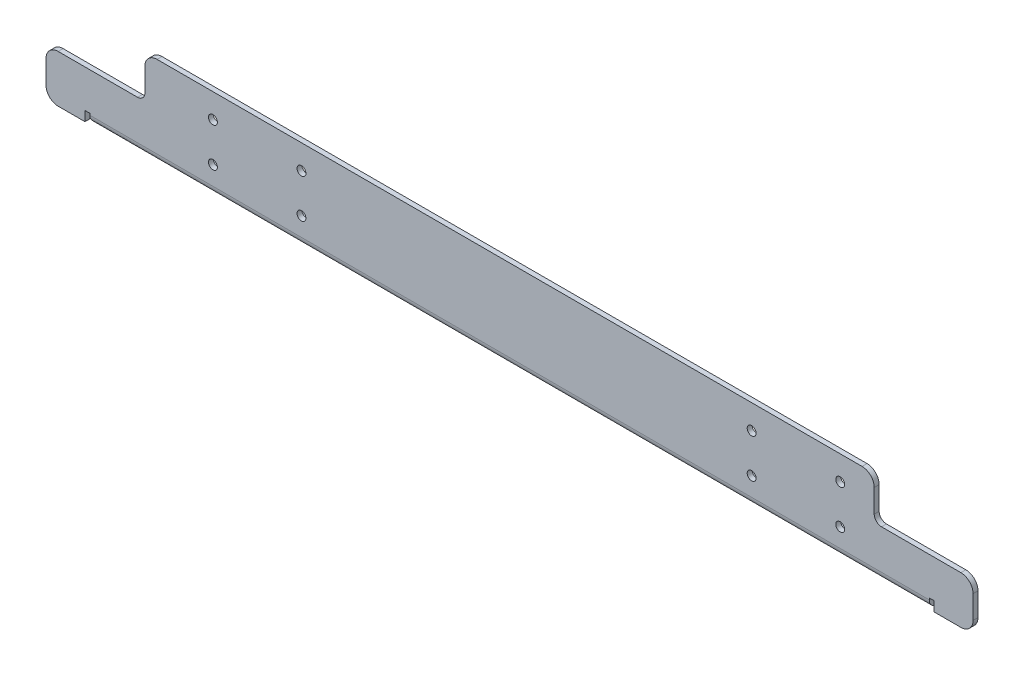
from build123d import *

# Parameters (mm, degrees)
BOSS_EXTRUDE1_START        = 8
SKETCH2_W                  = 381
SKETCH2_H                  = 2.032
BOSS_EXTRUDE1_DEPTH        = 37
SKETCH3_W                  = 345
SKETCH3_H                  = 2.032
BOSS_EXTRUDE2_DEPTH        = 10.668
SKETCH4_W                  = 40.623
SKETCH4_H                  = 17.5
CUT_EXTRUDE1_DEPTH         = 3
F_6_CLEARANCE_HOLE1_D      = 3.6576
FILLET2_R                  = 5
FILLET3_R                  = 3
SKETCH8_W                  = 2
SKETCH8_H                  = 4
CUT_EXTRUDE2_DEPTH         = 197.033303864
FLATTEN_BENDS1_START       = -11.684
FLATTEN_BENDS1_OUTLINE_W   = 345
FLATTEN_BENDS1_OUTLINE_H   = 2.032
FLATTEN_BENDS1_DEPTH       = 10.668
FLATTEN_BENDS1_START_2     = -1.016
FLATTEN_BENDS1_2_OUTLINE_W = 345
FLATTEN_BENDS1_2_OUTLINE_H = 9.367654589
FLATTEN_BENDS1_2_DEPTH     = 2.032
PROCESS_BENDS1_START       = -172.5
PROCESS_BENDS1_DEPTH       = 345
PROCESS_BENDS1_2_DEPTH     = 345


# Read off the part's stored shape, not the designer's step: Flatten-Bends1, Process-Bends1
with BuildPart() as part:
    # Sketch2 → Boss-Extrude1 (new body)
    with BuildSketch(Plane(origin=(0, 0, 0), x_dir=(1, 0, 0), z_dir=(0, 1, 0)).offset(BOSS_EXTRUDE1_START)):
        Rectangle(SKETCH2_W, SKETCH2_H)
    extrude(amount=BOSS_EXTRUDE1_DEPTH)

    # Sketch3 → Boss-Extrude2 (add)
    with BuildSketch(Plane(origin=(0, 0, -1.016), x_dir=(-1, 0, 0), z_dir=(0, 0, -1))):
        with Locations((0, 9.016)):
            Rectangle(SKETCH3_W, SKETCH3_H)
    extrude(amount=BOSS_EXTRUDE2_DEPTH)

    # Sketch4 → Cut-Extrude1 (cut)
    with BuildSketch(Plane.XY.offset(1.016)):
        with Locations((170.1885, 36.25)):
            Rectangle(SKETCH4_W, SKETCH4_H)
        with Locations((-170.1885, 36.25)):
            Rectangle(SKETCH4_W, SKETCH4_H)
    extrude(amount=-CUT_EXTRUDE1_DEPTH, mode=Mode.SUBTRACT)

    # #6 Clearance Hole1 (through all)
    with Locations(Plane.XY.offset(1.016)):
        with Locations((-121.9, 35), (-121.9, 19), (-85.5, 35), (-85.5, 19), (99.5, 19), (99.5, 35), (135.9, 35), (135.9, 19)):
            Hole(F_6_CLEARANCE_HOLE1_D / 2)

    # Fillet2
    fillet2_edges = [part.edges().sort_by_distance(p)[0] for p in [
        (-190.5, 27.5, 0),
        (-149.877, 45, 0),
        (190.5, 27.5, 0),
        (149.877, 45, 0),
        (-190.5, 8, 0),
        (190.5, 8, 0),
    ]]
    fillet(fillet2_edges, radius=FILLET2_R)

    # Fillet3
    fillet3_edges = [part.edges().sort_by_distance(p)[0] for p in [
        (-149.877, 27.5, 0),
        (149.877, 27.5, 0),
    ]]
    fillet(fillet3_edges, radius=FILLET3_R)

    # Sketch8 → Cut-Extrude2 (cut, through all)
    with BuildSketch(Plane(origin=(0, 0, -1.016), x_dir=(-1, 0, 0), z_dir=(0, 0, -1))):
        with Locations((173.5, 10)):
            Rectangle(SKETCH8_W, SKETCH8_H)
        with Locations((-173.5, 10)):
            Rectangle(SKETCH8_W, SKETCH8_H)
    extrude(amount=-CUT_EXTRUDE2_DEPTH, mode=Mode.SUBTRACT)

    # Flatten-Bends1 outline → Flatten-Bends1 (cut)
    with BuildSketch(Plane.XY.offset(FLATTEN_BENDS1_START)):
        with Locations((0, 9.016)):
            Rectangle(FLATTEN_BENDS1_OUTLINE_W, FLATTEN_BENDS1_OUTLINE_H)
    extrude(amount=FLATTEN_BENDS1_DEPTH, mode=Mode.SUBTRACT)

    # Flatten-Bends1 2 outline → Flatten-Bends1 2 (add)
    with BuildSketch(Plane.XY.offset(FLATTEN_BENDS1_START_2)):
        with Locations((0, 3.316172706)):
            Rectangle(FLATTEN_BENDS1_2_OUTLINE_W, FLATTEN_BENDS1_2_OUTLINE_H)
    extrude(amount=FLATTEN_BENDS1_2_DEPTH)

    # Process-Bends1 outline → Process-Bends1 (cut)
    with BuildSketch(Plane.YZ.offset(PROCESS_BENDS1_START)):
        with BuildLine():
            Line((-1.367654589, -1.016), (8.254000001, -1.016))
            ThreePointArc((8.254000001, -1.016), (9.470379953, 0.461430071), (11.302, 1.016))
            Line((11.302, 1.016), (-1.367654589, 1.016))
            Line((-1.367654589, 1.016), (-1.367654589, -1.016))
        make_face()
    extrude(amount=PROCESS_BENDS1_DEPTH, mode=Mode.SUBTRACT)

    # Process-Bends1 2 outline → Process-Bends1 2 (add)
    with BuildSketch(Plane.YZ.offset(PROCESS_BENDS1_START)):
        with BuildLine():
            Line((8, -2.286), (8, -11.684))
            Line((8, -11.684), (10.032, -11.684))
            Line((10.032, -11.684), (10.032, -2.286))
            ThreePointArc((10.032, -2.286), (10.403974388, -1.387974388), (11.302, -1.016))
            Line((11.302, -1.016), (8.254000001, -1.016))
            ThreePointArc((8.254000001, -1.016), (8.064122609, -1.638424522), (8, -2.286))
        make_face()
    extrude(amount=PROCESS_BENDS1_2_DEPTH)


solid = part.part
